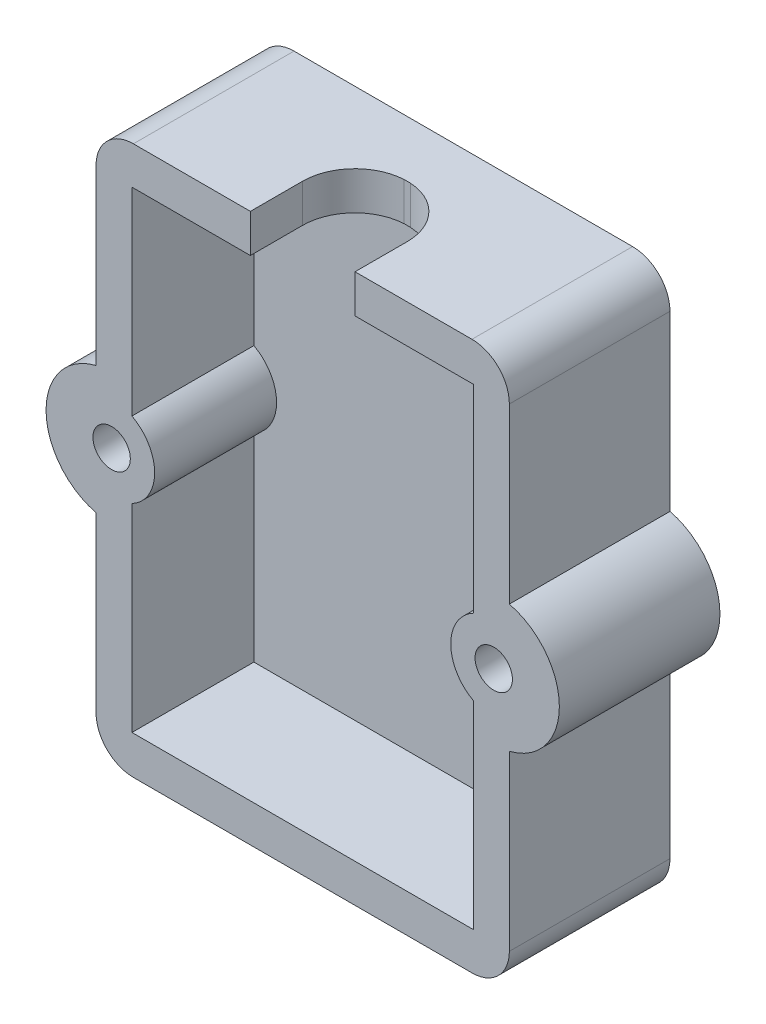
from build123d import *

# Parameters (mm, degrees)
BOSS_EXTRUDE2_DEPTH = 8.595
CUT_EXTRUDE3_REACH  = 34.509
SKETCH5_R           = 1
CUT_EXTRUDE4_DEPTH  = 6.525
CUT_EXTRUDE2_REACH  = 35.54


with BuildPart() as part:
    # Sketch1 → Boss-Extrude2 (new body)
    with BuildSketch(Plane.XY):
        with BuildLine():
            Line((-11.06, 0.816412174), (-11.06, 10.090766215))
            ThreePointArc((-11.06, 10.090766215), (-13.735, 13.5), (-11.06, 16.909233785))
            Line((-11.06, 16.909233785), (-11.06, 26.183587826))
            ThreePointArc((-11.06, 26.183587826), (-10.474213562, 27.597801388), (-9.06, 28.183587826))
            Line((-9.06, 28.183587826), (9.06, 28.183587826))
            ThreePointArc((9.06, 28.183587826), (10.474213562, 27.597801388), (11.06, 26.183587826))
            Line((11.06, 26.183587826), (11.06, 16.909233785))
            ThreePointArc((11.06, 16.909233785), (13.735, 13.5), (11.06, 10.090766215))
            Line((11.06, 10.090766215), (11.06, 0.816412174))
            ThreePointArc((11.06, 0.816412174), (10.474213562, -0.597801388), (9.06, -1.183587826))
            Line((9.06, -1.183587826), (-9.06, -1.183587826))
            ThreePointArc((-9.06, -1.183587826), (-10.474213562, -0.597801388), (-11.06, 0.816412174))
        make_face()
    extrude(amount=BOSS_EXTRUDE2_DEPTH)

    # Sketch5 → Cut-Extrude3 (cut, up to next)
    with BuildSketch(Plane.XY.offset(8.595), mode=Mode.PRIVATE) as cut_extrude3_sk1:
        with Locations((-10.225, 13.5)):
            Circle(SKETCH5_R)
    cut_extrude3_tool1 = extrude(cut_extrude3_sk1.sketch, amount=-CUT_EXTRUDE3_REACH, mode=Mode.PRIVATE) & part.part
    # Sketch5 → Cut-Extrude3 (cut, up to next)
    with BuildSketch(Plane.XY.offset(8.595), mode=Mode.PRIVATE) as cut_extrude3_sk2:
        with Locations((10.225, 13.5)):
            Circle(SKETCH5_R)
    cut_extrude3_tool2 = extrude(cut_extrude3_sk2.sketch, amount=-CUT_EXTRUDE3_REACH, mode=Mode.PRIVATE) & part.part
    add(cut_extrude3_tool1.solids().sort_by_distance((-10.225, 13.5, 8.595))[0], mode=Mode.SUBTRACT)
    add(cut_extrude3_tool2.solids().sort_by_distance((10.225, 13.5, 8.595))[0], mode=Mode.SUBTRACT)

    # Sketch2 → Cut-Extrude4 (cut)
    with BuildSketch(Plane.XY.offset(8.595)):
        with BuildLine():
            Line((-9.1375, 15.528570386), (-9.1375, 26.136412174))
            Line((-9.1375, 26.136412174), (9.1375, 26.136412174))
            Line((9.1375, 26.136412174), (9.1375, 15.528570386))
            ThreePointArc((9.1375, 15.528570386), (7.923314952, 13.5), (9.1375, 11.471429614))
            Line((9.1375, 11.471429614), (9.1375, 0.861412174))
            Line((9.1375, 0.861412174), (-9.1375, 0.861412174))
            Line((-9.1375, 0.861412174), (-9.1375, 11.471429614))
            ThreePointArc((-9.1375, 11.471429614), (-7.923314952, 13.5), (-9.1375, 15.528570386))
        make_face()
    extrude(amount=-CUT_EXTRUDE4_DEPTH, mode=Mode.SUBTRACT)

    # Sketch3 → Cut-Extrude2 (cut, up to next)
    with BuildSketch(Plane(origin=(0, 28.183587826, 0), x_dir=(1, 0, 0), z_dir=(0, 1, 0)), mode=Mode.PRIVATE) as cut_extrude2_sk1:
        with BuildLine():
            Line((0.167257287, -3.005), (-0.167257287, -3.005))
            ThreePointArc((-0.167257287, -3.005), (-2.038175704, -3.880145891), (-2.8, -5.8))
            Line((-2.8, -5.8), (-2.8, -8.595))
            Line((-2.8, -8.595), (-0.167257287, -8.595))
            Line((-0.167257287, -8.595), (0.167257287, -8.595))
            Line((0.167257287, -8.595), (2.8, -8.595))
            Line((2.8, -8.595), (2.8, -5.8))
            ThreePointArc((2.8, -5.8), (2.038175704, -3.880145891), (0.167257287, -3.005))
        make_face()
    cut_extrude2_tool1 = extrude(cut_extrude2_sk1.sketch, amount=-CUT_EXTRUDE2_REACH, mode=Mode.PRIVATE) & part.part
    add(cut_extrude2_tool1.solids().sort_by_distance((0, 28.183588, 6.058962))[0], mode=Mode.SUBTRACT)


solid = part.part
